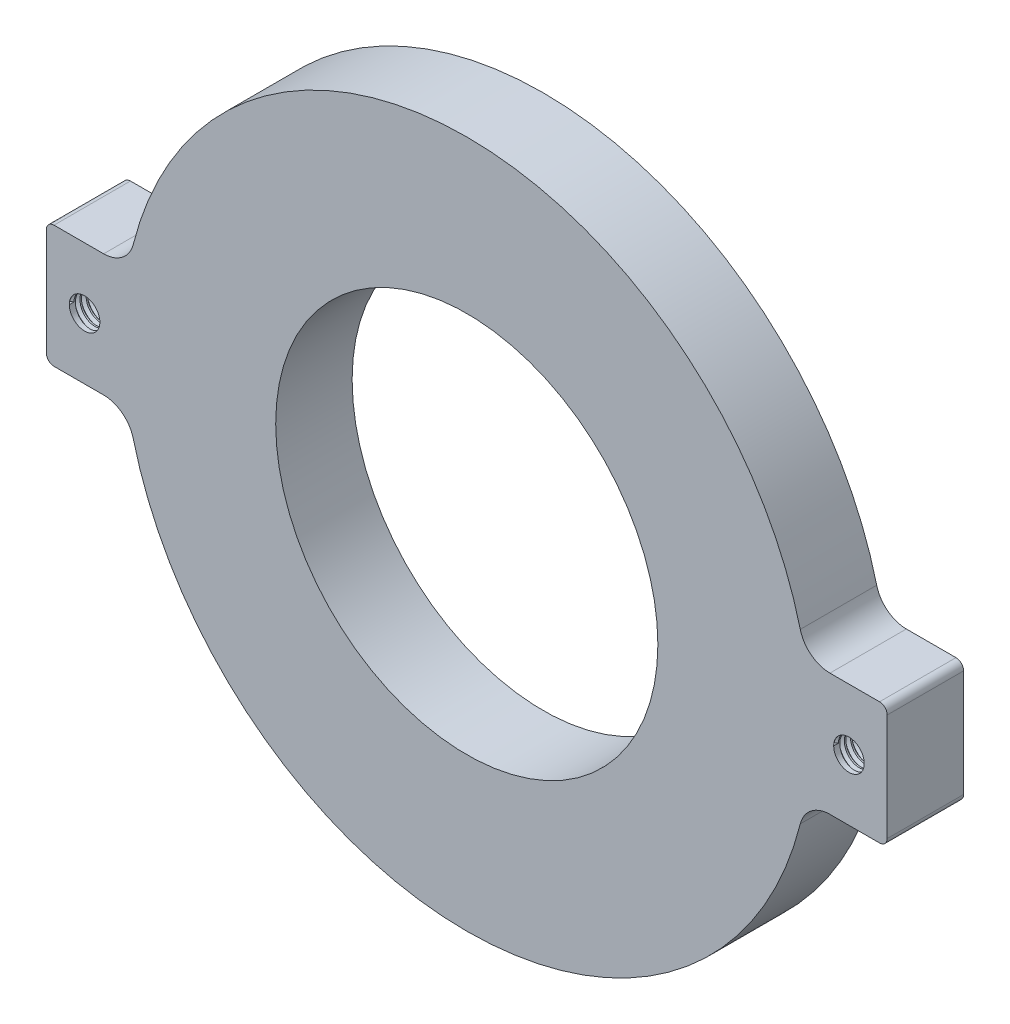
from build123d import *

# Parameters (mm, degrees)
SKETCH1_R            = 22.5
SKETCH1_R_2          = 12.5
BOSS_EXTRUDE1_DEPTH  = 5
SKETCH12_W           = 5
SKETCH12_H           = 8
BOSS_EXTRUDE4_DEPTH  = 5
FILLET2_R            = 0.5
FILLET2_OF_MIRROR2_R = 0.5
SKETCH13_R           = 1
CUT_EXTRUDE2_DEPTH   = 36.881750236
THREAD3_PITCH        = 0.4
THREAD4_PITCH        = 0.4
FILLET3_R            = 2


with BuildPart() as part:
    # Sketch1 → Boss-Extrude1 (new body)
    with BuildSketch(Plane.XY):
        Circle(SKETCH1_R)
        Circle(SKETCH1_R_2, mode=Mode.SUBTRACT)
    extrude(amount=BOSS_EXTRUDE1_DEPTH)

    # Sketch12 → Boss-Extrude4 (add, symmetric)
    with BuildSketch(Plane(origin=(22.5, 0, 0), x_dir=(0, 0, -1), z_dir=(1, 0, 0))):
        with Locations((-2.5, 0)):
            Rectangle(SKETCH12_W, SKETCH12_H)
    boss_extrude4 = extrude(amount=BOSS_EXTRUDE4_DEPTH, both=True)

    # Fillet2
    fillet2_edges = [part.edges().sort_by_distance(p)[0] for p in [
        (27.5, 4, 2.5),
        (27.5, -4, 2.5),
    ]]
    fillet(fillet2_edges, radius=FILLET2_R)

    # Mirror2: Boss-Extrude4 across plane
    add(boss_extrude4.mirror(Plane(origin=(0, 0, 0), x_dir=(0, 0, 1), z_dir=(1, 0, 0))))

    # Fillet2 of Mirror2
    fillet2_of_mirror2_edges = [part.edges().sort_by_distance(p)[0] for p in [
        (-27.5, 4, 2.5),
        (-27.5, -4, 2.5),
    ]]
    fillet(fillet2_of_mirror2_edges, radius=FILLET2_OF_MIRROR2_R)

    # Sketch13 → Cut-Extrude2 (cut, through all)
    with BuildSketch(Plane.XY.offset(5)):
        with Locations((25, 0)):
            Circle(SKETCH13_R)
        with Locations(Location((-25, 0, 0), (0, 0, 180))):
            Circle(SKETCH13_R)
    extrude(amount=-CUT_EXTRUDE2_DEPTH, mode=Mode.SUBTRACT)

    # Thread3: the profile of Thread Profile3 profile screwed along a right-hand helix of 12.5 turns, 6 arcs to a turn; built about Z, then put on its axis
    thread3_z = Axis((0, 0, 0), (0, 0, 1))
    thread3_corners = [(0.9997, 0, -0.000173205), (1.21650635, 0, 0.124999999), (1.21650635, 0, 0.174999999), (0.9997, 0, 0.300173204)]
    with BuildLine(mode=Mode.PRIVATE) as thread3_profile:
        Line(thread3_corners[0], thread3_corners[1])
        Line(thread3_corners[1], thread3_corners[2])
        Line(thread3_corners[2], thread3_corners[3])
        Line(thread3_corners[3], thread3_corners[0])
    thread3_cap = Face(thread3_profile.wire())
    thread3_turn_angles = [0, 30, 60, 90, 120, 150, 180, 210, 240, 270, 300, 330, 360]
    thread3_turn_weights = [1, 0.8660254037844387, 1, 0.8660254037844387, 1, 0.8660254037844387, 1, 0.8660254037844387, 1, 0.8660254037844387, 1, 0.8660254037844387, 1]
    thread3_turn_rails = [Edge.make_bspline([Vector(p[0], p[1], 0).rotate(thread3_z, thread3_turn_angles[k]) / thread3_turn_weights[k] + Vector(0, 0, p[2] + THREAD3_PITCH * thread3_turn_angles[k] / 360) for k in range(13)], [0, 0, 0, 1, 1, 2, 2, 3, 3, 4, 4, 5, 5, 6, 6, 6], 2, thread3_turn_weights) for p in thread3_corners]
    thread3_turn_sides = [Face.make_surface_from_curves(thread3_turn_rails[p[0]], thread3_turn_rails[p[1]]) for p in [(0, 1), (1, 2), (2, 3), (3, 0)]]
    thread3_last_angles = [4320, 4350, 4380, 4410, 4440, 4470, 4500]
    thread3_last_weights = [1, 0.8660254037844387, 1, 0.8660254037844387, 1, 0.8660254037844387, 1]
    thread3_last_rails = [Edge.make_bspline([Vector(p[0], p[1], 0).rotate(thread3_z, thread3_last_angles[k]) / thread3_last_weights[k] + Vector(0, 0, p[2] + THREAD3_PITCH * thread3_last_angles[k] / 360) for k in range(7)], [0, 0, 0, 1, 1, 2, 2, 3, 3, 3], 2, thread3_last_weights) for p in thread3_corners]
    thread3_last_sides = [Face.make_surface_from_curves(thread3_last_rails[p[0]], thread3_last_rails[p[1]]) for p in [(0, 1), (1, 2), (2, 3), (3, 0)]]
    thread3 = Plane(origin=(-25, 0, 5), x_dir=(-1, 0, 0), z_dir=(0, 0, -1)) * Solid(Shell([*[p.moved(Location((0, 0, THREAD3_PITCH * i))) for i in range(12) for p in thread3_turn_sides], *thread3_last_sides, thread3_cap, thread3_cap.rotate(thread3_z, 4500).moved(Location((0, 0, THREAD3_PITCH * 4500 / 360)))]))
    add(thread3, mode=Mode.SUBTRACT)

    # Thread4: the profile of Thread Profile4 profile screwed along a right-hand helix of 12.5 turns, 6 arcs to a turn; built about Z, then put on its axis
    thread4_z = Axis((0, 0, 0), (0, 0, 1))
    thread4_corners = [(0.9997, 0, -0.000173205), (1.21650635, 0, 0.124999999), (1.21650635, 0, 0.174999999), (0.9997, 0, 0.300173204)]
    with BuildLine(mode=Mode.PRIVATE) as thread4_profile:
        Line(thread4_corners[0], thread4_corners[1])
        Line(thread4_corners[1], thread4_corners[2])
        Line(thread4_corners[2], thread4_corners[3])
        Line(thread4_corners[3], thread4_corners[0])
    thread4_cap = Face(thread4_profile.wire())
    thread4_turn_angles = [0, 30, 60, 90, 120, 150, 180, 210, 240, 270, 300, 330, 360]
    thread4_turn_weights = [1, 0.8660254037844387, 1, 0.8660254037844387, 1, 0.8660254037844387, 1, 0.8660254037844387, 1, 0.8660254037844387, 1, 0.8660254037844387, 1]
    thread4_turn_rails = [Edge.make_bspline([Vector(p[0], p[1], 0).rotate(thread4_z, thread4_turn_angles[k]) / thread4_turn_weights[k] + Vector(0, 0, p[2] + THREAD4_PITCH * thread4_turn_angles[k] / 360) for k in range(13)], [0, 0, 0, 1, 1, 2, 2, 3, 3, 4, 4, 5, 5, 6, 6, 6], 2, thread4_turn_weights) for p in thread4_corners]
    thread4_turn_sides = [Face.make_surface_from_curves(thread4_turn_rails[p[0]], thread4_turn_rails[p[1]]) for p in [(0, 1), (1, 2), (2, 3), (3, 0)]]
    thread4_last_angles = [4320, 4350, 4380, 4410, 4440, 4470, 4500]
    thread4_last_weights = [1, 0.8660254037844387, 1, 0.8660254037844387, 1, 0.8660254037844387, 1]
    thread4_last_rails = [Edge.make_bspline([Vector(p[0], p[1], 0).rotate(thread4_z, thread4_last_angles[k]) / thread4_last_weights[k] + Vector(0, 0, p[2] + THREAD4_PITCH * thread4_last_angles[k] / 360) for k in range(7)], [0, 0, 0, 1, 1, 2, 2, 3, 3, 3], 2, thread4_last_weights) for p in thread4_corners]
    thread4_last_sides = [Face.make_surface_from_curves(thread4_last_rails[p[0]], thread4_last_rails[p[1]]) for p in [(0, 1), (1, 2), (2, 3), (3, 0)]]
    thread4 = Plane(origin=(25, 0, 5), x_dir=(-1, 0, 0), z_dir=(0, 0, -1)) * Solid(Shell([*[p.moved(Location((0, 0, THREAD4_PITCH * i))) for i in range(12) for p in thread4_turn_sides], *thread4_last_sides, thread4_cap, thread4_cap.rotate(thread4_z, 4500).moved(Location((0, 0, THREAD4_PITCH * 4500 / 360)))]))
    add(thread4, mode=Mode.SUBTRACT)

    # Fillet3
    fillet3_edges = [part.edges().sort_by_distance(p)[0] for p in [
        (22.141589825, 4, 2.5),
        (22.141589825, -4, 2.5),
        (-22.141589825, -4, 2.5),
        (-22.141589825, 4, 2.5),
    ]]
    fillet(fillet3_edges, radius=FILLET3_R)


solid = part.part
